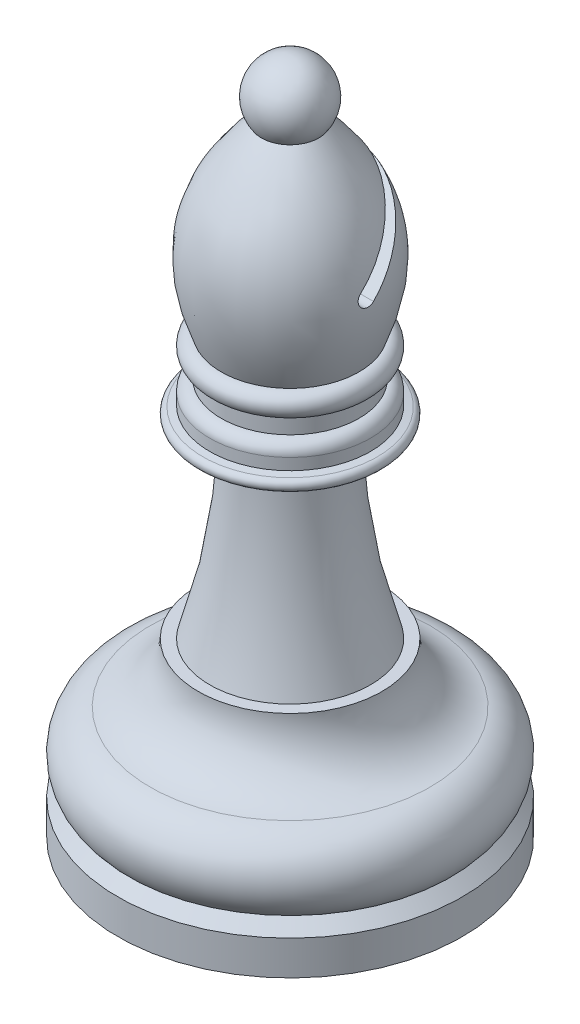
from build123d import *

# Parameters (mm, degrees)
CUT_EXTRUDE1_DEPTH      = 10
CUT_EXTRUDE1_DEPTH_BACK = 10


with BuildPart() as part:
    # Sketch1 → Revolve1 (revolve)
    with BuildSketch(Plane(origin=(0, 0, 0), x_dir=(0, 0, -1), z_dir=(1, 0, 0))):
        with BuildLine():
            Line((0, 0), (0, 59))
            ThreePointArc((0, 59), (2.795084972, 57.272542486), (2.5, 54))
            add(Edge.make_bspline(
                [(2.5, 54), (7.045365916, 49.229383097), (8.609509614, 44.613405666), (6, 38.1)],
                knots=[0, 0, 0, 0, 1, 1, 1, 1], degree=3))
            ThreePointArc((6, 38.1), (7, 37.1), (6, 36.1))
            Line((6, 36.1), (6, 34.6))
            ThreePointArc((6, 34.6), (6.707106781, 34.307106781), (7, 33.6))
            Line((7, 33.6), (7, 32.6))
            Line((7, 32.6), (7.590163934, 32.491803279))
            ThreePointArc((7.590163934, 32.491803279), (7.999978956, 31.995412706), (7.58112495, 31.50662515))
            Line((7.58112495, 31.50662515), (4.5, 31))
            ThreePointArc((4.5, 31), (5.12876883, 22.90293263), (7, 15))
            Line((7, 15), (8, 15))
            ThreePointArc((8, 15), (9.181403324, 11.691917943), (12.191085437, 9.880582997))
            ThreePointArc((12.191085437, 9.880582997), (14.845305765, 7.478532666), (14, 4))
            Line((14, 4), (15, 3))
            Line((15, 3), (15, 0))
            Line((15, 0), (0, 0))
        make_face()
    revolve(axis=Axis((0, 0, 0), (0, 1, 0)))

    # Sketch2 → Cut-Extrude1 (cut, two sides: drawn at the far end of the back side and taken through both)
    with BuildSketch(Plane(origin=(0, 0, 0), x_dir=(0, 0, -1), z_dir=(1, 0, 0)).offset(-CUT_EXTRUDE1_DEPTH_BACK)):
        with BuildLine():
            Line((5.140367971, 51.217885421), (-1.012046912, 45.065470538))
            ThreePointArc((-1.012046912, 45.065470538), (-1.012046912, 44.053423626), (0, 44.053423626))
            Line((0, 44.053423626), (6.152414883, 50.205838509))
            Line((6.152414883, 50.205838509), (5.140367971, 51.217885421))
        make_face()
    extrude(amount=CUT_EXTRUDE1_DEPTH + CUT_EXTRUDE1_DEPTH_BACK, mode=Mode.SUBTRACT)


solid = part.part
